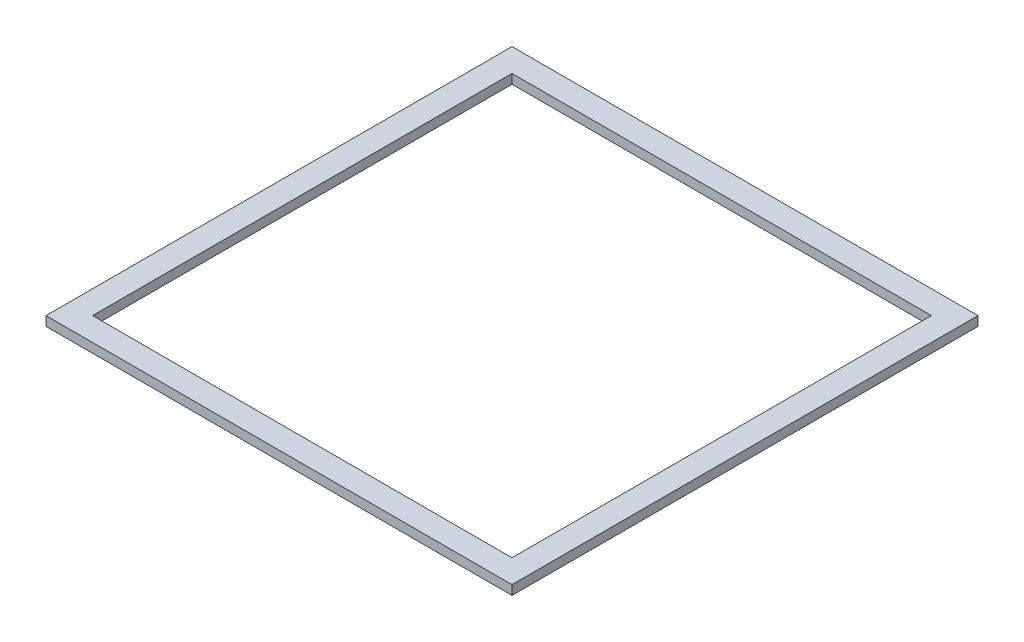
from build123d import *

# Parameters (mm, degrees)
SKETCH1_W           = 1000
SKETCH1_H           = 1000
SKETCH1_W_2         = 900
SKETCH1_H_2         = 900
BOSS_EXTRUDE1_DEPTH = 20


with BuildPart() as part:
    # Sketch1 → Boss-Extrude1 (new body)
    with BuildSketch(Plane(origin=(0, 0, 0), x_dir=(1, 0, 0), z_dir=(0, 1, 0))):
        Rectangle(SKETCH1_W, SKETCH1_H)
        Rectangle(SKETCH1_W_2, SKETCH1_H_2, mode=Mode.SUBTRACT)
    extrude(amount=BOSS_EXTRUDE1_DEPTH)


solid = part.part
